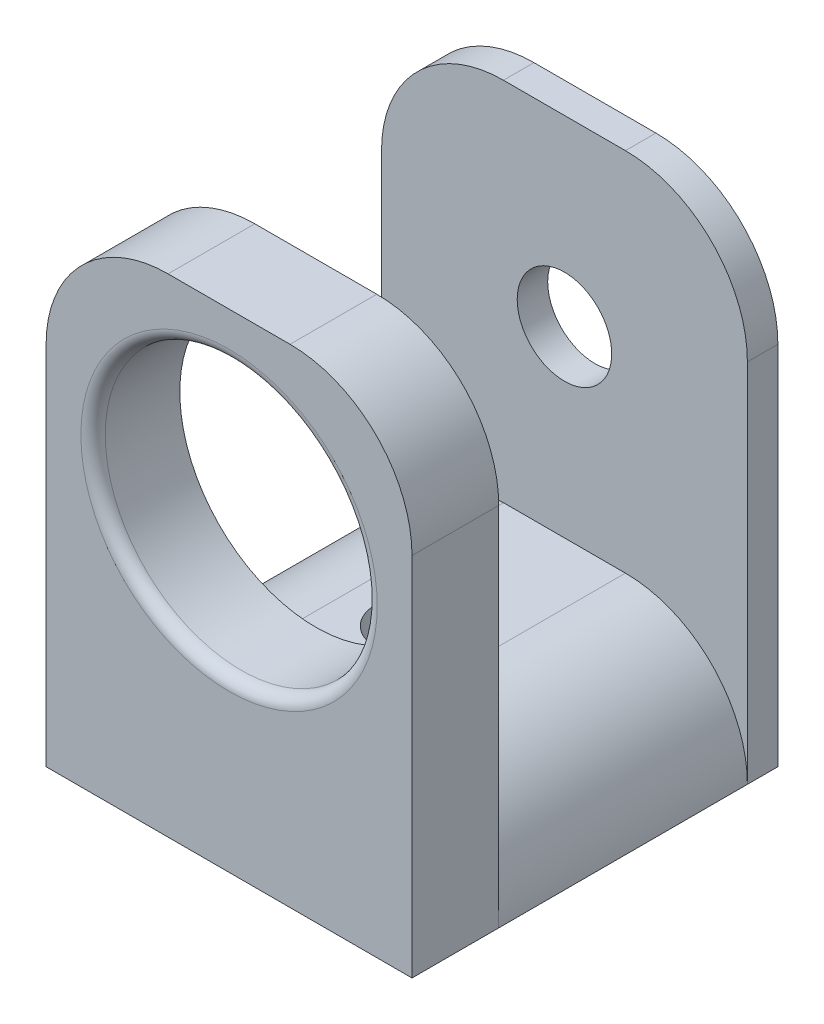
from build123d import *

# Parameters (mm, degrees)
SKETCH1_W           = 30
SKETCH1_H           = 30
BOSS_EXTRUDE1_DEPTH = 10
SKETCH2_W           = 30
SKETCH2_H           = 2.5
BOSS_EXTRUDE2_DEPTH = 30
SKETCH3_W           = 30
SKETCH3_H           = 7.112
BOSS_EXTRUDE3_DEPTH = 30
CUT_EXTRUDE2_REACH  = 55.205
SKETCH4_R           = 11.1506
FILLET2_R           = 1
SKETCH5_R           = 3.875
CUT_EXTRUDE3_DEPTH  = 30
SKETCH6_R           = 3
CUT_EXTRUDE4_DEPTH  = 30
FILLET3_R           = 1
FILLET4_R           = 10
FILLET5_R           = 10
FILLET6_R           = 10
FILLET7_R           = 10


with BuildPart() as part:
    # Sketch1 → Boss-Extrude1 (new body)
    with BuildSketch(Plane(origin=(0, 0, 0), x_dir=(1, 0, 0), z_dir=(0, 1, 0))):
        with Locations((3.18772861, 17.116506927)):
            Rectangle(SKETCH1_W, SKETCH1_H)
    extrude(amount=BOSS_EXTRUDE1_DEPTH)

    # Sketch2 → Boss-Extrude2 (add)
    with BuildSketch(Plane(origin=(0, 10, 0), x_dir=(1, 0, 0), z_dir=(0, 1, 0))):
        with Locations((3.18772861, 30.866506927)):
            Rectangle(SKETCH2_W, SKETCH2_H)
    extrude(amount=BOSS_EXTRUDE2_DEPTH)

    # Sketch3 → Boss-Extrude3 (add)
    with BuildSketch(Plane(origin=(0, 10, 0), x_dir=(1, 0, 0), z_dir=(0, 1, 0))):
        with Locations((3.18772861, 5.672506927)):
            Rectangle(SKETCH3_W, SKETCH3_H)
    extrude(amount=BOSS_EXTRUDE3_DEPTH)

    # Sketch4 → Cut-Extrude2 (cut, up to next)
    with BuildSketch(Plane.XY.offset(-2.116506927), mode=Mode.PRIVATE) as cut_extrude2_sk1:
        with Locations((3.18772861, 25)):
            Circle(SKETCH4_R)
    cut_extrude2_tool1 = extrude(cut_extrude2_sk1.sketch, amount=-CUT_EXTRUDE2_REACH, mode=Mode.PRIVATE) & part.part
    add(cut_extrude2_tool1.solids().sort_by_distance((3.187729, 25, -2.116507))[0], mode=Mode.SUBTRACT)

    # Fillet2
    fillet2_edges = [part.edges().sort_by_distance(p)[0] for p in [
        (-7.96287139, 25, -2.116506927),
    ]]
    fillet(fillet2_edges, radius=FILLET2_R)

    # Sketch5 → Cut-Extrude3 (cut)
    with BuildSketch(Plane(origin=(0, 0, -32.116506927), x_dir=(-1, 0, 0), z_dir=(0, 0, -1))):
        with Locations((-3.18772861, 25)):
            Circle(SKETCH5_R)
    extrude(amount=-CUT_EXTRUDE3_DEPTH, mode=Mode.SUBTRACT)

    # Sketch6 → Cut-Extrude4 (cut)
    with BuildSketch(Plane(origin=(0, 0, 0), x_dir=(-1, 0, 0), z_dir=(0, -1, 0))):
        with Locations(Location((-3.18772861, 17.116506927, 0), (0, 0, 90))):
            Circle(SKETCH6_R)
    extrude(amount=-CUT_EXTRUDE4_DEPTH, mode=Mode.SUBTRACT)

    # Fillet3
    fillet3_edges = [part.edges().sort_by_distance(p)[0] for p in [
        (3.18772861, 0, -14.116506927),
    ]]
    fillet(fillet3_edges, radius=FILLET3_R)

    # Fillet4
    fillet4_edges = [part.edges().sort_by_distance(p)[0] for p in [
        (-11.81227139, 40, -30.866506927),
        (18.18772861, 40, -30.866506927),
    ]]
    fillet(fillet4_edges, radius=FILLET4_R)

    # Fillet5
    fillet5_edges = [part.edges().sort_by_distance(p)[0] for p in [
        (18.18772861, 10, -19.422506927),
    ]]
    fillet(fillet5_edges, radius=FILLET5_R - 0.0001)  # a hair under: the kernel refuses the full size

    # Fillet6
    fillet6_edges = [part.edges().sort_by_distance(p)[0] for p in [
        (-11.81227139, 10, -19.422506927),
    ]]
    fillet(fillet6_edges, radius=FILLET6_R - 0.0001)  # a hair under: the kernel refuses the full size

    # Fillet7
    fillet7_edges = [part.edges().sort_by_distance(p)[0] for p in [
        (-11.81227139, 40, -5.672506927),
        (18.18772861, 40, -5.672506927),
    ]]
    fillet(fillet7_edges, radius=FILLET7_R)


solid = part.part
